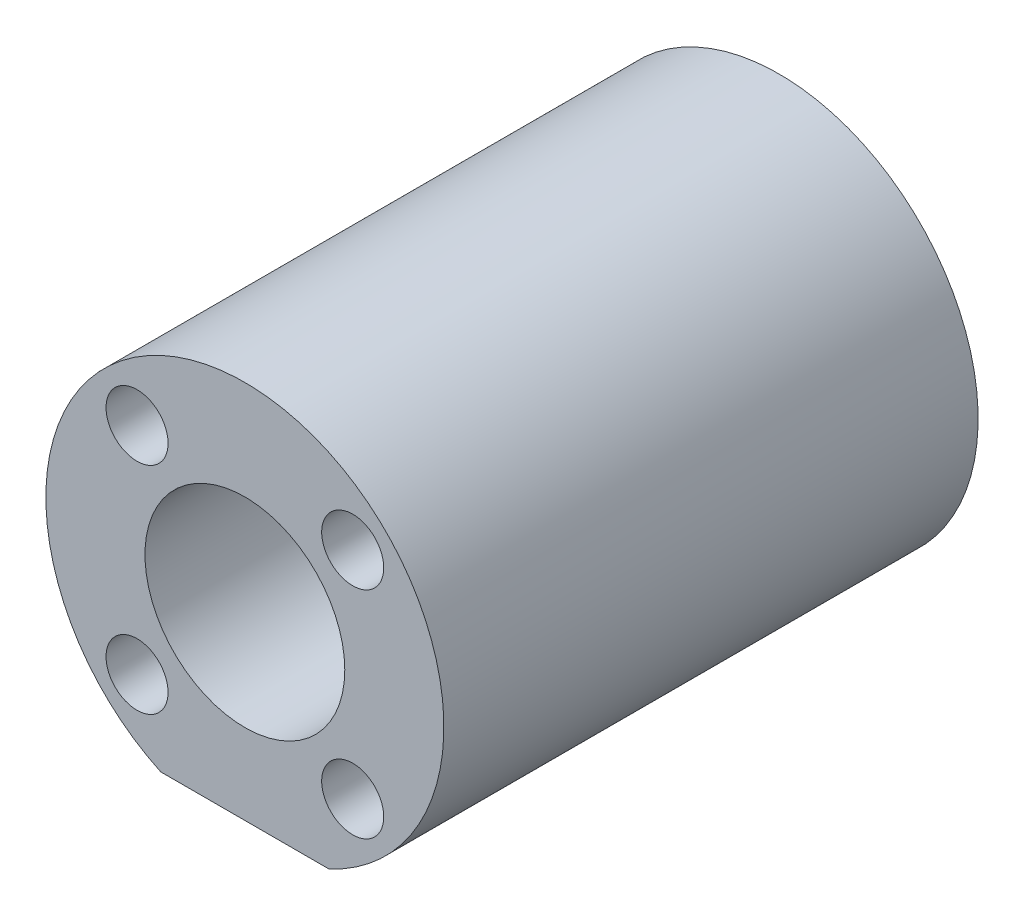
from build123d import *

# Parameters (mm, degrees)
SKETCH1_R           = 4.750000025
BOSS_EXTRUDE1_DEPTH = 25.4
SKETCH3_R           = 1.474999971
CUT_EXTRUDE1_DEPTH  = 19.05


with BuildPart() as part:
    # Sketch1 → Boss-Extrude1 (new body)
    with BuildSketch(Plane.XY):
        with BuildLine():
            Line((-3.998602683, -8.575031127), (3.998602683, -8.575031127))
            ThreePointArc((3.998602683, -8.575031127), (0, 9.4615), (-3.998602683, -8.575031127))
        make_face()
        Circle(SKETCH1_R, mode=Mode.SUBTRACT)
    extrude(amount=BOSS_EXTRUDE1_DEPTH)

    # Sketch3 → Cut-Extrude1 (cut)
    with BuildSketch(Plane(origin=(0, 0, 25.4), x_dir=(-1, 0, 0), z_dir=(0, 0, -1))):
        with Locations((5.126524148, -5.126524148)):
            Circle(SKETCH3_R)
        with Locations((-5.126524148, -5.126524148)):
            Circle(SKETCH3_R)
        with Locations((-5.126524148, 5.126524148)):
            Circle(SKETCH3_R)
        with Locations((5.126524148, 5.126524148)):
            Circle(SKETCH3_R)
    extrude(amount=CUT_EXTRUDE1_DEPTH, mode=Mode.SUBTRACT)


solid = part.part
